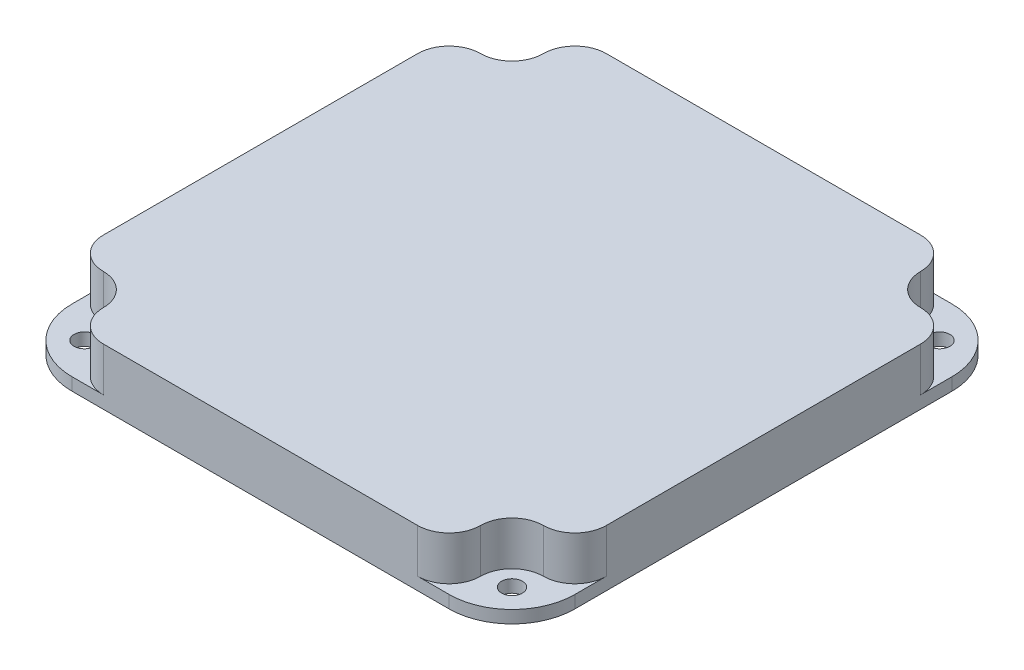
from build123d import *

# Parameters (mm, degrees)
SKETCH_1_R      = 1.65
EXTRUDE_1_DEPTH = 2
EXTRUDE_2_DEPTH = 7
FILLET_1_R      = 5


with BuildPart() as part:
    # 草图1 → 凸台-拉伸1 (new body)
    with BuildSketch(Plane(origin=(0, 0, 0), x_dir=(1, 0, 0), z_dir=(0, 1, 0))):
        with BuildLine():
            Line((-30, -40), (30, -40))
            ThreePointArc((30, -40), (37.071067812, -37.071067812), (40, -30))
            Line((40, -30), (40, 30))
            ThreePointArc((40, 30), (37.071067812, 37.071067812), (30, 40))
            Line((30, 40), (-30, 40))
            ThreePointArc((-30, 40), (-37.071067812, 37.071067812), (-40, 30))
            Line((-40, 30), (-40, -30))
            ThreePointArc((-40, -30), (-37.071067812, -37.071067812), (-30, -40))
        make_face()
        with Locations(Location((-34, 34, 0), (0, 0, 270))):
            Circle(SKETCH_1_R, mode=Mode.SUBTRACT)
        with Locations(Location((-34, -34, 0), (0, 0, 90))):
            Circle(SKETCH_1_R, mode=Mode.SUBTRACT)
        with Locations(Location((34, 34, 0), (0, 0, 90))):
            Circle(SKETCH_1_R, mode=Mode.SUBTRACT)
        with Locations(Location((34, -34, 0), (0, 0, 270))):
            Circle(SKETCH_1_R, mode=Mode.SUBTRACT)
    extrude(amount=EXTRUDE_1_DEPTH)

    # 草图2 → 凸台-拉伸2 (add)
    with BuildSketch(Plane(origin=(0, 2, 0), x_dir=(1, 0, 0), z_dir=(0, 1, 0))):
        Polygon((-30, 40), (-30, 30), (-40, 30), (-40, -30), (-30, -30), (-30, -40), (30, -40), (30, -30), (40, -30), (40, 30), (30, 30), (30, 40), align=None)
    extrude(amount=EXTRUDE_2_DEPTH)

    # 圆角1
    fillet_1_edges = [part.edges().sort_by_distance(p)[0] for p in [
        (-40, 5.5, -30),
        (-30, 5.5, -30),
        (-30, 5.5, -40),
        (30, 5.5, -40),
        (30, 5.5, -30),
        (40, 5.5, -30),
        (40, 5.5, 30),
        (30, 5.5, 30),
        (30, 5.5, 40),
        (-40, 5.5, 30),
        (-30, 5.5, 30),
        (-30, 5.5, 40),
    ]]
    fillet(fillet_1_edges, radius=FILLET_1_R - 0.0001)  # a hair under: the kernel refuses the full size


solid = part.part
